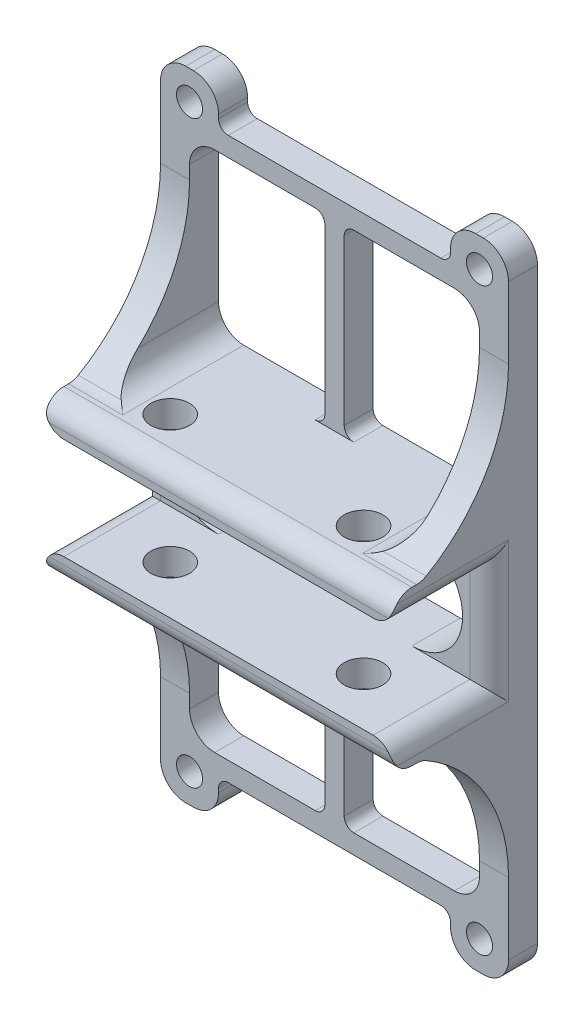
from build123d import *

# Parameters (mm, degrees)
SKETCH1_R                           = 1.35
BOSS_EXTRUDE1_DEPTH                 = 15
CUT_EXTRUDE2_DEPTH                  = 52.088159098
CUT_EXTRUDE2_DEPTH_BACK             = 52.088159098
FILLET2_R                           = 2
FILLET3_R                           = 2
CUT_EXTRUDE3_DEPTH                  = 15
SKETCH4_R                           = 2
CUT_EXTRUDE4_DEPTH                  = 48.222875882
CUT_EXTRUDE_THIN1_REACH             = 42.472
CUT_EXTRUDE_THIN1_DIRECTION_2_REACH = 42.472


with BuildPart() as part:
    # Sketch1 → Boss-Extrude1 (new body)
    with BuildSketch(Plane.XY):
        with BuildLine():
            ThreePointArc((-15.4, 33), (-17.238477631, 32.238477631), (-18, 30.4))
            Line((-18, 30.4), (-18, -30.4))
            ThreePointArc((-18, -30.4), (-17.238477631, -32.238477631), (-15.4, -33))
            Line((-15.4, -33), (-14.6, -33))
            ThreePointArc((-14.6, -33), (-12.761522369, -32.238477631), (-12, -30.4))
            Line((-12, -30.4), (-12, -30))
            ThreePointArc((-12, -30), (-11.707106781, -29.292893219), (-11, -29))
            Line((-11, -29), (11, -29))
            ThreePointArc((11, -29), (11.707106781, -29.292893219), (12, -30))
            Line((12, -30), (12, -30.4))
            ThreePointArc((12, -30.4), (12.761522369, -32.238477631), (14.6, -33))
            Line((14.6, -33), (15.4, -33))
            ThreePointArc((15.4, -33), (17.238477631, -32.238477631), (18, -30.4))
            Line((18, -30.4), (18, 30.4))
            ThreePointArc((18, 30.4), (17.238477631, 32.238477631), (15.4, 33))
            Line((15.4, 33), (14.6, 33))
            ThreePointArc((14.6, 33), (12.761522369, 32.238477631), (12, 30.4))
            Line((12, 30.4), (12, 30))
            ThreePointArc((12, 30), (11.707106781, 29.292893219), (11, 29))
            Line((11, 29), (-11, 29))
            ThreePointArc((-11, 29), (-11.707106781, 29.292893219), (-12, 30))
            Line((-12, 30), (-12, 30.4))
            ThreePointArc((-12, 30.4), (-12.761522369, 32.238477631), (-14.6, 33))
            Line((-14.6, 33), (-15.4, 33))
        make_face()
        with Locations((-15, -30)):
            Circle(SKETCH1_R, mode=Mode.SUBTRACT)
        with BuildLine():
            Line((-12.4, -8), (-2, -8))
            ThreePointArc((-2, -8), (-1.292893219, -8.292893219), (-1, -9))
            Line((-1, -9), (-1, -26))
            ThreePointArc((-1, -26), (-1.292893219, -26.707106781), (-2, -27))
            Line((-2, -27), (-12.4, -27))
            ThreePointArc((-12.4, -27), (-14.238477631, -26.238477631), (-15, -24.4))
            Line((-15, -24.4), (-15, -10.6))
            ThreePointArc((-15, -10.6), (-14.238477631, -8.761522369), (-12.4, -8))
        make_face(mode=Mode.SUBTRACT)
        with BuildLine():
            ThreePointArc((2, -27), (1.292893219, -26.707106781), (1, -26))
            Line((1, -26), (1, -9))
            ThreePointArc((1, -9), (1.292893219, -8.292893219), (2, -8))
            Line((2, -8), (12.4, -8))
            ThreePointArc((12.4, -8), (14.238477631, -8.761522369), (15, -10.6))
            Line((15, -10.6), (15, -24.4))
            ThreePointArc((15, -24.4), (14.238477631, -26.238477631), (12.4, -27))
            Line((12.4, -27), (2, -27))
        make_face(mode=Mode.SUBTRACT)
        with Locations((15, -30)):
            Circle(SKETCH1_R, mode=Mode.SUBTRACT)
        with Locations((-15, 30)):
            Circle(SKETCH1_R, mode=Mode.SUBTRACT)
        with BuildLine():
            ThreePointArc((-12.4, 8), (-14.238477631, 8.761522369), (-15, 10.6))
            Line((-15, 10.6), (-15, 24.4))
            ThreePointArc((-15, 24.4), (-14.238477631, 26.238477631), (-12.4, 27))
            Line((-12.4, 27), (-2, 27))
            ThreePointArc((-2, 27), (-1.292893219, 26.707106781), (-1, 26))
            Line((-1, 26), (-1, 9))
            ThreePointArc((-1, 9), (-1.292893219, 8.292893219), (-2, 8))
            Line((-2, 8), (-12.4, 8))
        make_face(mode=Mode.SUBTRACT)
        with BuildLine():
            ThreePointArc((1, 26), (1.292893219, 26.707106781), (2, 27))
            Line((2, 27), (12.4, 27))
            ThreePointArc((12.4, 27), (14.238477631, 26.238477631), (15, 24.4))
            Line((15, 24.4), (15, 10.6))
            ThreePointArc((15, 10.6), (14.238477631, 8.761522369), (12.4, 8))
            Line((12.4, 8), (2, 8))
            ThreePointArc((2, 8), (1.292893219, 8.292893219), (1, 9))
            Line((1, 9), (1, 26))
        make_face(mode=Mode.SUBTRACT)
        with Locations((15, 30)):
            Circle(SKETCH1_R, mode=Mode.SUBTRACT)
    extrude(amount=BOSS_EXTRUDE1_DEPTH)

    # Sketch2 → Cut-Extrude2 (cut, two sides: drawn at the far end of the back side and taken through both)
    with BuildSketch(Plane(origin=(18, 0, 0), x_dir=(0, 0, -1), z_dir=(1, 0, 0)).offset(-CUT_EXTRUDE2_DEPTH_BACK)):
        with BuildLine():
            Line((-3, 177.16407865), (-3, 33))
            Line((-3, 33), (-3, 23))
            ThreePointArc((-3, 23), (-5.422620263, 14.253572158), (-12, 8))
            Line((-12, 8), (-15, 8))
            Line((-15, 8), (-15, 5.25))
            Line((-15, 5.25), (-5, 5.25))
            Line((-5, 5.25), (-5, -5.25))
            Line((-5, -5.25), (-15, -5.25))
            Line((-15, -5.25), (-15, -8))
            Line((-15, -8), (-12, -8))
            ThreePointArc((-12, -8), (-5.422620263, -14.253572158), (-3, -23))
            Line((-3, -23), (-3, -33))
            Line((-3, -33), (-3, -177.16407865))
            Line((-3, -177.16407865), (-291.3281573, -177.16407865))
            Line((-291.3281573, -177.16407865), (-291.3281573, 177.16407865))
            Line((-291.3281573, 177.16407865), (-3, 177.16407865))
        make_face()
    extrude(amount=CUT_EXTRUDE2_DEPTH + CUT_EXTRUDE2_DEPTH_BACK, mode=Mode.SUBTRACT)

    # Fillet2
    fillet2_edges = [part.edges().sort_by_distance(p)[0] for p in [
        (15.2, -8, 12),
        (0, -8, 12),
        (-15.2, -8, 12),
        (-15.2, 8, 12),
        (0, 8, 12),
        (15.2, 8, 12),
        (0, -8, 15),
        (0, 8, 15),
    ]]
    fillet(fillet2_edges, radius=FILLET2_R)

    # Fillet3
    fillet3_edges = [part.edges().sort_by_distance(p)[0] for p in [
        (-18, -5.25, 10),
        (-18, 0, 5),
        (-18, 5.25, 10),
        (18, 5.25, 10),
        (18, 0, 5),
        (18, -5.25, 10),
    ]]
    fillet(fillet3_edges, radius=FILLET3_R)

    # Sketch3 → Cut-Extrude3 (cut)
    with BuildSketch(Plane.XY.offset(5)):
        with BuildLine():
            Line((-10, 5.25), (10, 5.25))
            ThreePointArc((10, 5.25), (15.25, 0), (10, -5.25))
            Line((10, -5.25), (-10, -5.25))
            ThreePointArc((-10, -5.25), (-15.25, 0), (-10, 5.25))
        make_face()
    extrude(amount=-CUT_EXTRUDE3_DEPTH, mode=Mode.SUBTRACT)

    # Sketch4 → Cut-Extrude4 (cut, through all)
    with BuildSketch(Plane.XZ.offset(8)):
        with Locations((10, 10)):
            Circle(SKETCH4_R)
        with Locations((-10, 10)):
            Circle(SKETCH4_R)
    extrude(amount=-CUT_EXTRUDE4_DEPTH, mode=Mode.SUBTRACT)

    # Sketch6 → Cut-Extrude-Thin1 (cut, up to next)
    with BuildSketch(Plane(origin=(0, 0, 0), x_dir=(0, 0, -1), z_dir=(1, 0, 0)), mode=Mode.PRIVATE) as cut_extrude_thin1_sk1:
        Polygon((-17.654346394, 8), (-3, 8), (-3, 24.623705197), (-13, 24.623705197), (-13, 18), (-17.654346394, 18), align=None)
    cut_extrude_thin1_tool1 = extrude(cut_extrude_thin1_sk1.sketch, amount=-CUT_EXTRUDE_THIN1_REACH, mode=Mode.PRIVATE) & part.part
    # Sketch6 → Cut-Extrude-Thin1 (cut, up to next)
    with BuildSketch(Plane(origin=(0, 0, 0), x_dir=(0, 0, -1), z_dir=(1, 0, 0)), mode=Mode.PRIVATE) as cut_extrude_thin1_sk2:
        Polygon((-15.529649095, -8), (-3, -8), (-3, -39.060889623), (-13, -39.060889623), (-13, -18), (-15.529649095, -18), align=None)
    cut_extrude_thin1_tool2 = extrude(cut_extrude_thin1_sk2.sketch, amount=-CUT_EXTRUDE_THIN1_REACH, mode=Mode.PRIVATE) & part.part
    add(cut_extrude_thin1_tool1.solids().sort_by_distance((0, 15.58742, 9.602741))[0], mode=Mode.SUBTRACT)
    add(cut_extrude_thin1_tool2.solids().sort_by_distance((0, -22.737414, 8.471794))[0], mode=Mode.SUBTRACT)

    # Sketch6 → Cut-Extrude-Thin1 direction 2 (cut, up to next)
    with BuildSketch(Plane(origin=(0, 0, 0), x_dir=(0, 0, -1), z_dir=(1, 0, 0)), mode=Mode.PRIVATE) as cut_extrude_thin1_direction_2_sk1:
        Polygon((-17.654346394, 8), (-3, 8), (-3, 24.623705197), (-13, 24.623705197), (-13, 18), (-17.654346394, 18), align=None)
    cut_extrude_thin1_direction_2_tool1 = extrude(cut_extrude_thin1_direction_2_sk1.sketch, amount=CUT_EXTRUDE_THIN1_DIRECTION_2_REACH, mode=Mode.PRIVATE) & part.part
    # Sketch6 → Cut-Extrude-Thin1 direction 2 (cut, up to next)
    with BuildSketch(Plane(origin=(0, 0, 0), x_dir=(0, 0, -1), z_dir=(1, 0, 0)), mode=Mode.PRIVATE) as cut_extrude_thin1_direction_2_sk2:
        Polygon((-15.529649095, -8), (-3, -8), (-3, -39.060889623), (-13, -39.060889623), (-13, -18), (-15.529649095, -18), align=None)
    cut_extrude_thin1_direction_2_tool2 = extrude(cut_extrude_thin1_direction_2_sk2.sketch, amount=CUT_EXTRUDE_THIN1_DIRECTION_2_REACH, mode=Mode.PRIVATE) & part.part
    add(cut_extrude_thin1_direction_2_tool1.solids().sort_by_distance((0, 15.58742, 9.602741))[0], mode=Mode.SUBTRACT)
    add(cut_extrude_thin1_direction_2_tool2.solids().sort_by_distance((0, -22.737414, 8.471794))[0], mode=Mode.SUBTRACT)


solid = part.part
